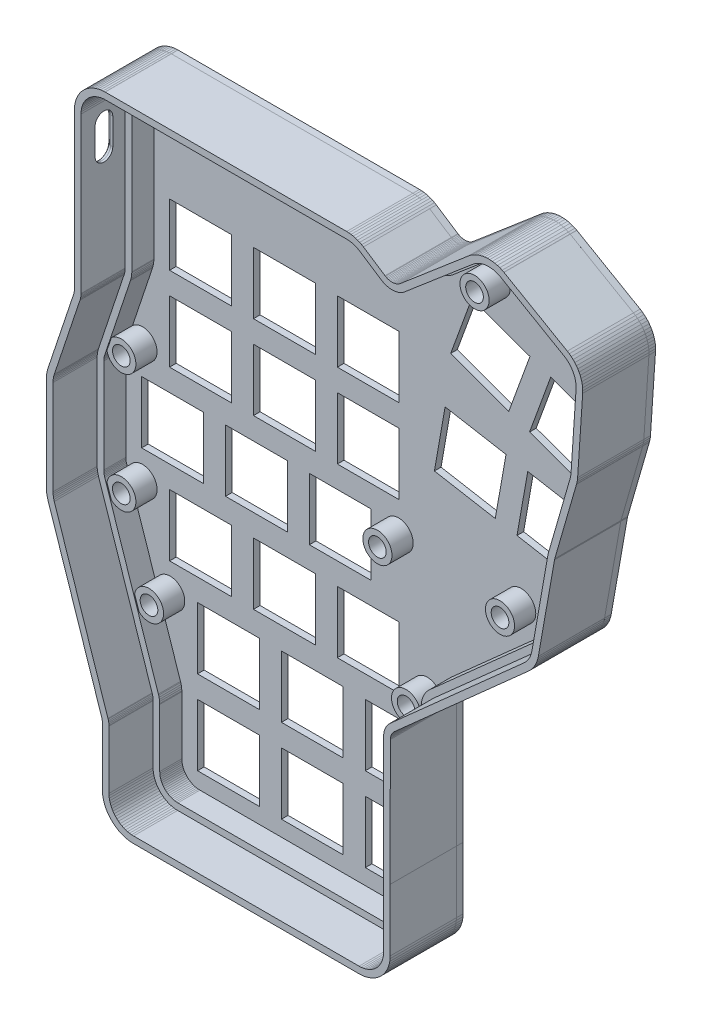
from build123d import *

# Parameters (mm, degrees)
BOSS_EXTRU_1_DEPTH      = 15
ESQUISSE7_W             = 14
ESQUISSE7_H             = 14
BOSS_EXTRU_4_DEPTH      = 1.5
ESQUISSE6_R             = 3.3
ESQUISSE6_R_2           = 2
BOSS_EXTRU_3_DEPTH      = 4.8
ENL_V_MAT_EXTRU_1_DEPTH = 1.5
CONG_1_R                = 1
BOSS_EXTRU_6_DEPTH      = 5


# Read off the part's stored shape, not the designer's step: Boss.-Extru.1, Boss.-Extru.6
with BuildPart() as part:
    # Boss.-Extru.1 outline → Boss.-Extru.1 (new body)
    with BuildSketch(Plane(origin=(0, 0, 0), x_dir=(0, 1, 0), z_dir=(0, 0, 1))):
        Polygon((92.890611184, -113.577539073), (93.43365663, -113.6), (107.473866744, -113.6), (135.881963197, -113.615550131), (136.127746965, -113.636438947), (136.370779918, -113.677913112), (136.609463594, -113.739688722), (136.842102766, -113.821327786), (137.067049329, -113.922251404), (137.282708136, -114.041744237), (137.487545421, -114.178956128), (137.680111288, -114.332916408), (137.859211104, -114.502694203), (137.905542913, -114.554664077), (165.010079912, -144.972955359), (165.037680756, -144.998391426), (165.307449273, -145.279408378), (165.698437591, -145.630402332), (166.114391048, -145.951418588), (166.553021612, -146.240688552), (167.011907492, -146.496613359), (167.488515384, -146.71778199), (167.980220027, -146.902976886), (168.484313313, -147.051176809), (168.938901203, -147.148861525), (168.98446908, -147.157776056), (189.726222944, -150.815137777), (189.777290349, -150.824140806), (189.878703518, -150.845754626), (189.979287041, -150.870948457), (207.036579721, -155.792284367), (207.07970119, -155.80389521), (207.512878427, -155.912301204), (208.009868843, -155.999609992), (208.476336025, -156.047632122), (225.577473488, -157.193574526), (226.100468696, -157.207753169), (226.662689396, -157.178224032), (227.220779935, -157.104095672), (227.771213577, -156.985838939), (228.310504374, -156.824199645), (228.835239223, -156.620203411), (229.342097756, -156.375139099), (229.827869484, -156.090560421), (230.289485828, -155.768265199), (230.724019033, -155.410293915), (231.128718139, -155.018918104), (231.501028693, -154.596607506), (231.838591121, -154.146034836), (232.118006497, -153.703711275), (240.392168816, -139.372442446), (240.409288301, -139.334567479), (240.6129388, -138.945907525), (240.838975505, -138.412391682), (241.02060847, -137.86217168), (241.156618893, -137.298937181), (241.246095602, -136.726465003), (241.288439793, -136.14859307), (241.283366894, -135.569190757), (241.230910317, -134.992147494), (241.131423005, -134.421329857), (240.985571098, -133.860564784), (240.794332009, -133.313609221), (240.558988167, -132.784134379), (240.281118344, -132.275686415), (239.962583612, -131.791676379), (239.630773978, -131.367619294), (226.497075815, -115.929518886), (226.41593607, -115.834194414), (226.270749831, -115.630561218), (226.143356067, -115.415038473), (226.034841663, -115.189421732), (225.945999109, -114.955356276), (225.877478213, -114.714557935), (225.829781211, -114.468786228), (225.803255113, -114.219835987), (225.798095215, -113.969532189), (225.814338608, -113.719704043), (225.8518675, -113.472173954), (225.910406127, -113.228754967), (225.989526605, -112.991230208), (226.088651163, -112.761332098), (226.208726848, -112.537627729), (226.27498831, -112.436153953), (229.469816673, -107.540749632), (229.714951025, -107.133666809), (229.946389499, -106.677761657), (230.144306928, -106.206335778), (230.30766857, -105.721844577), (230.435619903, -105.226826504), (230.527494713, -104.723861371), (230.582812937, -104.215572762), (230.599978167, -103.740753368), (230.600038397, -49.043095703), (230.595853087, -49.000737957), (230.577519345, -48.557302879), (230.505179011, -47.976896773), (230.38515628, -47.404452395), (230.218272052, -46.843874393), (230.005664168, -46.298992111), (229.748787209, -45.773527785), (229.449392245, -45.271068769), (229.109529637, -44.795054768), (228.731518792, -44.348729444), (228.317938879, -43.935144898), (227.871618833, -43.557125075), (227.395605387, -43.217255942), (226.893154507, -42.917856199), (226.367692563, -42.660971481), (225.822813936, -42.448356923), (225.262236448, -42.281464066), (224.689791378, -42.161433954), (224.109391659, -42.089087223), (223.566343567, -42.066625439), (188.336506682, -42.066667), (188.242363927, -42.066655716), (188.054343274, -42.054539863), (187.867606955, -42.030373679), (187.682585221, -41.99420577), (187.500613653, -41.946304458), (187.41131672, -41.916550692), (169.920395126, -36.08621789), (169.51493006, -35.965411261), (169.071164343, -35.863742546), (168.621786248, -35.790819777), (168.168643572, -35.746943017), (167.745789774, -35.733333), (146.275020194, -35.733333), (146.234802643, -35.733942615), (145.831347869, -35.74692949), (145.378193774, -35.790809874), (144.928801731, -35.86374071), (144.485031709, -35.965420171), (144.07958845, -36.086228077), (107.588674011, -48.249865223), (107.499352713, -48.279628892), (107.317162447, -48.327589712), (107.132373208, -48.36371455), (106.945646947, -48.387880696), (106.757639166, -48.399996314), (106.663551385, -48.400007003), (93.433657028, -48.399999984), (92.890611184, -48.422460927), (92.310211298, -48.494806629), (91.737770398, -48.614835976), (91.177197004, -48.781724707), (90.632316588, -48.994338146), (90.106858283, -49.251219793), (89.604407347, -49.550614897), (89.128394182, -49.89048167), (88.68207455, -50.268495326), (88.268495326, -50.68207455), (87.89048167, -51.128394182), (87.550614897, -51.604407347), (87.251219793, -52.106858283), (86.994338146, -52.632316588), (86.781724707, -53.177197004), (86.614835976, -53.737770398), (86.494806629, -54.310211298), (86.422460927, -54.890611184), (86.4, -55.43365663), (86.4, -106.56634337), (86.422460927, -107.109388816), (86.494806629, -107.689788702), (86.614835976, -108.262229602), (86.781724707, -108.822802996), (86.994338146, -109.367683412), (87.251219793, -109.893141717), (87.550614897, -110.395592653), (87.89048167, -110.871605818), (88.268495326, -111.31792545), (88.68207455, -111.731504674), (89.128394182, -112.10951833), (89.604407347, -112.449385103), (90.106858283, -112.748780207), (90.632316588, -113.005661854), (91.177197004, -113.218275293), (91.737770398, -113.385164024), (92.310211298, -113.505193371), align=None)
        Polygon((145.927863967, -37.244599622), (146.270301747, -37.233576835), (146.286388, -37.233333), (167.721656444, -37.233333), (168.072133893, -37.244613504), (168.429169562, -37.279184444), (168.783242836, -37.336641636), (169.132889765, -37.416747315), (169.468950531, -37.516875223), (186.937059323, -43.339603723), (187.072163838, -43.384620589), (187.347429881, -43.457080286), (187.627214739, -43.51177242), (187.909707068, -43.548330716), (188.193994982, -43.566649929), (188.33641767, -43.566667), (223.535335892, -43.566625475), (223.985415185, -43.585241845), (224.442687179, -43.642240725), (224.893690127, -43.736806889), (225.33534377, -43.86829422), (225.764629662, -44.035803875), (226.178617058, -44.238191577), (226.574476261, -44.474075617), (226.949505607, -44.741843051), (227.301140549, -45.039667403), (227.626981528, -45.365512031), (227.924799326, -45.717151745), (228.192562693, -46.092183034), (228.428441895, -46.488046846), (228.630823773, -46.90203671), (228.798328058, -47.331325198), (228.929808643, -47.772979417), (229.024369233, -48.223982972), (229.081362711, -48.68125709), (229.098905149, -49.105553045), (229.100038315, -49.117021338), (229.099978197, -103.713648092), (229.085751213, -104.107190611), (229.042166732, -104.50766433), (228.969779537, -104.90394526), (228.868967952, -105.293965089), (228.740257449, -105.675689376), (228.58432026, -106.047121174), (228.401971934, -106.406324808), (228.198817179, -106.743694135), (225.018934894, -111.616196726), (224.91755405, -111.771452837), (224.736647791, -112.108486275), (224.586690901, -112.456279052), (224.466995782, -112.815611492), (224.378438125, -113.183857489), (224.321664152, -113.558322761), (224.297090804, -113.936268047), (224.304896778, -114.314931497), (224.345025553, -114.691544307), (224.417182303, -115.063351484), (224.520841527, -115.427634069), (224.655243166, -115.781729933), (224.819405767, -116.123047118), (225.012128458, -116.449092305), (225.231963517, -116.757425353), (225.354710454, -116.901630721), (238.468368494, -132.316174824), (238.743371153, -132.667631845), (238.994331836, -133.048963854), (239.213254042, -133.449549095), (239.398672002, -133.866701055), (239.549341274, -134.297624446), (239.664252001, -134.739428214), (239.742634079, -135.189152623), (239.783962473, -135.643781439), (239.787959198, -136.100268268), (239.7545979, -136.555550501), (239.684102723, -137.006578795), (239.576945867, -137.45032742), (239.433844876, -137.883822671), (239.25575995, -138.304157631), (239.060393575, -138.67700762), (239.055944204, -138.686851362), (230.833896624, -152.927854819), (230.60231803, -153.294451209), (230.336363673, -153.649442626), (230.043031535, -153.982168276), (229.724179758, -154.290522979), (229.381824707, -154.5725573), (229.018132371, -154.826483105), (228.635406689, -155.050694525), (228.236068556, -155.243773103), (227.822645593, -155.404495661), (227.397755144, -155.531846235), (226.964084984, -155.625017168), (226.524381599, -155.683420758), (226.081426424, -155.706685792), (225.647971622, -155.694934632), (208.603326756, -154.55277778), (208.216706211, -154.512975748), (207.825122607, -154.444184301), (207.45680849, -154.35201081), (207.439519059, -154.347355475), (190.44494083, -149.444114804), (190.36955926, -149.422364364), (190.217371629, -149.384244907), (190.063928837, -149.351542201), (169.258724484, -145.682994786), (169.240489127, -145.679427368), (168.853932857, -145.596361716), (168.456769645, -145.479598492), (168.069366568, -145.333687581), (167.693857104, -145.159433408), (167.332312109, -144.957796493), (166.986726094, -144.729887947), (166.659004315, -144.476965374), (166.35095245, -144.200424267), (166.087972988, -143.92647945), (166.080879959, -143.919942739), (139.052097173, -113.586677636), (139.051897728, -113.586428269), (138.936913776, -113.457452051), (138.666184822, -113.200814352), (138.374869355, -112.967901782), (138.064989534, -112.760326309), (137.738742332, -112.579558351), (137.398443941, -112.426881446), (137.046506149, -112.30337743), (136.68542448, -112.209923028), (136.317761741, -112.147180487), (135.946064313, -112.115590447), (135.922675359, -112.115572192), (107.474277282, -112.1), (93.464664158, -112.1), (93.014585296, -112.081384268), (92.557314324, -112.024386343), (92.10631335, -111.929820506), (91.664661751, -111.798336073), (91.235376147, -111.630827964), (90.821389821, -111.428441802), (90.425530337, -111.192561276), (90.050501046, -110.924795583), (89.698865637, -110.626975419), (89.373024581, -110.301134363), (89.075204417, -109.949498954), (88.807438724, -109.574469663), (88.571558198, -109.178610179), (88.369172036, -108.764623853), (88.201663927, -108.335338249), (88.070179494, -107.89368665), (87.975613657, -107.442685676), (87.918615732, -106.985414704), (87.9, -106.535335842), (87.9, -55.464664158), (87.918615732, -55.014585296), (87.975613657, -54.557314324), (88.070179494, -54.10631335), (88.201663927, -53.664661751), (88.369172036, -53.235376147), (88.571558198, -52.821389821), (88.807438724, -52.425530337), (89.075204417, -52.050501046), (89.373024581, -51.698865637), (89.698865637, -51.373024581), (90.050501046, -51.075204417), (90.425530337, -50.807438724), (90.821389821, -50.571558198), (91.235376147, -50.369172036), (91.664661751, -50.201663927), (92.10631335, -50.070179494), (92.557314324, -49.975613657), (93.014585296, -49.918615732), (93.464664158, -49.9), (106.663636196, -49.900007003), (106.806005792, -49.899990828), (107.090290487, -49.881670924), (107.372779552, -49.845111137), (107.652334112, -49.790460428), (107.927822678, -49.717939223), (108.062943253, -49.672914306), (144.531044612, -37.516881519), (144.867099927, -37.416748793), (145.216747933, -37.336635177), (145.570823944, -37.279172968), align=None, mode=Mode.SUBTRACT)
    extrude(amount=BOSS_EXTRU_1_DEPTH)

    # Esquisse7 → Boss.-Extru.4 (add)
    with BuildSketch(Plane(origin=(0, 0, 0), x_dir=(1, 0, 0), z_dir=(0, 0, -1))):
        Polygon((113.600270421, -106.680013171), (113.600268673, -107.473879916), (113.615756242, -135.881976403), (113.636644516, -136.127760217), (113.678118146, -136.370793261), (113.73989323, -136.609477073), (113.821531782, -136.842116424), (113.922454905, -137.06706321), (114.041947262, -137.28272228), (114.179158702, -137.487559867), (114.333118559, -137.680126073), (114.502895959, -137.859226264), (114.554865731, -137.905558187), (144.973097321, -165.010162175), (144.998533327, -165.037763075), (145.279549685, -165.307532211), (145.630542778, -165.698521302), (145.951558118, -166.114475465), (146.240827116, -166.553106666), (146.496750913, -167.01199311), (146.717918494, -167.488601489), (146.903112307, -167.98030654), (147.05131112, -168.484400153), (147.148994835, -168.938988258), (147.157909265, -168.984556155), (150.815225307, -189.726318072), (150.824228224, -189.777385497), (150.845841821, -189.878798714), (150.87103543, -189.979382293), (150.885411575, -190.029206821), (155.792333775, -207.03668581), (155.803944524, -207.079807305), (155.912349564, -207.512984781), (155.999657257, -208.009975389), (156.047678359, -208.476442677), (157.193583102, -225.577582663), (157.207760593, -226.100577903), (157.178230219, -226.662798538), (157.104100629, -227.220888914), (156.985842684, -227.771322296), (156.824202203, -228.310612736), (156.620204813, -228.835347136), (156.375139385, -229.342205129), (156.090559637, -229.827976231), (155.768263399, -230.289591865), (155.410291158, -230.724124281), (155.018914455, -231.128822526), (154.596603037, -231.50113215), (154.146029624, -231.838693585), (153.703705447, -232.118107988), (139.372418397, -240.392238745), (139.334543392, -240.409358146), (138.945882989, -240.61300779), (138.412366649, -240.83904332), (137.862146247, -241.020675073), (137.298911448, -241.156684255), (136.726439073, -241.246159704), (136.148567047, -241.288502622), (135.569164744, -241.283428447), (134.992121597, -241.230970599), (134.421304179, -241.13148203), (133.860539427, -240.985628888), (133.313584286, -240.794388595), (132.784109962, -240.559043586), (132.27566261, -240.281172644), (131.791653275, -239.962636846), (131.367596922, -239.630826278), (115.929525437, -226.497094116), (115.834201144, -226.415954161), (115.630568268, -226.270767473), (115.415045803, -226.143373235), (115.189429301, -226.034858334), (114.955364041, -225.946015265), (114.714565851, -225.877493839), (114.468794249, -225.829796295), (114.219844066, -225.803269649), (113.969540279, -225.798109199), (113.719712098, -225.814352043), (113.472181926, -225.851880389), (113.22876281, -225.91041848), (112.991237877, -225.989538435), (112.761339549, -226.088662487), (112.537634915, -226.208737679), (112.436160994, -226.274998918), (107.540749637, -229.4698165), (107.133666274, -229.714949955), (106.677760612, -229.946387426), (106.206334298, -230.144303816), (105.721842736, -230.307664391), (105.226824381, -230.435614634), (104.723859046, -230.527488336), (104.215570316, -230.582805441), (103.740750884, -230.599969625), (49.043093218, -230.599909396), (49.000735482, -230.595723993), (48.557300444, -230.577389274), (47.976894498, -230.505047662), (47.404450384, -230.385023671), (46.84387275, -230.218138208), (46.298990936, -230.005529124), (45.773527175, -229.748651008), (45.271068819, -229.449254938), (44.795055566, -229.109391281), (44.348731074, -228.731379453), (43.935147439, -228.317798629), (43.5571286, -227.87147775), (43.217260514, -227.395463557), (42.917861878, -226.893012017), (42.660978318, -226.367549507), (42.448364959, -225.822670412), (42.281473337, -225.262092556), (42.161444485, -224.689647222), (42.089099033, -224.109247344), (42.066638444, -223.566199202), (42.066757591, -188.336362317), (42.066746514, -188.242219562), (42.054631076, -188.054198882), (42.030465303, -187.86746251), (41.994297801, -187.682440696), (41.94639689, -187.500469024), (41.916643321, -187.411172025), (36.086349039, -169.92023759), (35.965543302, -169.514772258), (35.863875565, -169.071006318), (35.790953785, -168.621628062), (35.747078023, -168.168485289), (35.733468938, -167.745631462), (35.733516222, -146.274861882), (35.734125926, -146.234644332), (35.747113689, -145.831189587), (35.790995071, -145.378035589), (35.863926897, -144.928643706), (35.965607335, -144.484873908), (36.086416134, -144.079430915), (48.250133643, -107.588543264), (48.279897508, -107.499222031), (48.32785873, -107.317031871), (48.363983974, -107.132242711), (48.388150532, -106.945516504), (48.400266564, -106.757508749), (48.40027746, -106.663420968), (48.400299577, -93.433526611), (48.422761716, -92.890480817), (48.495108696, -92.31008109), (48.615139304, -91.737640455), (48.782029269, -91.177067428), (48.994643908, -90.632187481), (49.251526713, -90.106729741), (49.550922923, -89.604279464), (49.890790744, -89.128267048), (50.268805383, -88.681948248), (50.682385518, -88.268369935), (51.128705983, -87.890357262), (51.604719896, -87.550491537), (52.107171492, -87.25109754), (52.632630363, -86.99421705), (53.177511246, -86.781604811), (53.738085008, -86.614717315), (54.310526172, -86.494689228), (54.890926218, -86.422344804), (55.433971713, -86.399885073), (106.566658453, -86.399997681), (107.109703849, -86.422459804), (107.690103576, -86.494806784), (108.262544211, -86.614837392), (108.823117238, -86.781727358), (109.367997186, -86.994341996), (109.893454925, -87.251224801), (110.395905202, -87.550621011), (110.871917618, -87.890488832), (111.318236418, -88.268503471), (111.731814731, -88.682083606), (112.109827404, -89.128404071), (112.449693129, -89.604417984), (112.749087126, -90.10686958), (113.005967616, -90.632328451), (113.218579855, -91.177209335), (113.385467351, -91.737783097), (113.505495438, -92.31022426), (113.577839862, -92.890624306), (113.600299593, -93.433669801), align=None)
        Polygon((129.985643815, -221.938205772), (142.109999428, -214.938205795), (149.109999405, -227.062561409), (136.985643792, -234.062561386), align=None, mode=Mode.SUBTRACT)
        Polygon((112.308368192, -203.476419086), (125.464064792, -198.688137086), (130.252346792, -211.843833686), (117.096650192, -216.632115686), align=None, mode=Mode.SUBTRACT)
        Polygon((130.162527992, -196.978036386), (143.318224592, -192.189754386), (148.106506592, -205.345450986), (134.950809992, -210.133732986), align=None, mode=Mode.SUBTRACT)
        Polygon((108.608626892, -178.556247086), (122.395935392, -176.125172586), (124.827009892, -189.912481086), (111.039701392, -192.343555586), align=None, mode=Mode.SUBTRACT)
        Polygon((127.319974192, -175.256931686), (141.107282692, -172.825857186), (143.538357192, -186.613165686), (129.751048692, -189.044240186), align=None, mode=Mode.SUBTRACT)
        with Locations((55.629165692, -194.935048686)):
            Rectangle(ESQUISSE7_W, ESQUISSE7_H, mode=Mode.SUBTRACT)
        with Locations((74.629165692, -194.935048686)):
            Rectangle(ESQUISSE7_W, ESQUISSE7_H, mode=Mode.SUBTRACT)
        with Locations((93.629165692, -194.935048686)):
            Rectangle(ESQUISSE7_W, ESQUISSE7_H, mode=Mode.SUBTRACT)
        with Locations((55.629165692, -175.935048686)):
            Rectangle(ESQUISSE7_W, ESQUISSE7_H, mode=Mode.SUBTRACT)
        with Locations((74.629165692, -175.935048686)):
            Rectangle(ESQUISSE7_W, ESQUISSE7_H, mode=Mode.SUBTRACT)
        with Locations((93.629165692, -175.935048686)):
            Rectangle(ESQUISSE7_W, ESQUISSE7_H, mode=Mode.SUBTRACT)
        with Locations((49.295832292, -156.935048686)):
            Rectangle(ESQUISSE7_W, ESQUISSE7_H, mode=Mode.SUBTRACT)
        with Locations((68.295832292, -156.935048686)):
            Rectangle(ESQUISSE7_W, ESQUISSE7_H, mode=Mode.SUBTRACT)
        with Locations((87.295832292, -156.935048686)):
            Rectangle(ESQUISSE7_W, ESQUISSE7_H, mode=Mode.SUBTRACT)
        with Locations((55.629165692, -137.935048686)):
            Rectangle(ESQUISSE7_W, ESQUISSE7_H, mode=Mode.SUBTRACT)
        with Locations((74.629165692, -137.935048686)):
            Rectangle(ESQUISSE7_W, ESQUISSE7_H, mode=Mode.SUBTRACT)
        with Locations((93.629165692, -137.935048686)):
            Rectangle(ESQUISSE7_W, ESQUISSE7_H, mode=Mode.SUBTRACT)
        with Locations((61.962498992, -118.935048686)):
            Rectangle(ESQUISSE7_W, ESQUISSE7_H, mode=Mode.SUBTRACT)
        with Locations((80.962498992, -118.935048686)):
            Rectangle(ESQUISSE7_W, ESQUISSE7_H, mode=Mode.SUBTRACT)
        with Locations((99.962498992, -118.935048686)):
            Rectangle(ESQUISSE7_W, ESQUISSE7_H, mode=Mode.SUBTRACT)
        with Locations((61.962498992, -99.935048686)):
            Rectangle(ESQUISSE7_W, ESQUISSE7_H, mode=Mode.SUBTRACT)
        with Locations((80.962498992, -99.935048686)):
            Rectangle(ESQUISSE7_W, ESQUISSE7_H, mode=Mode.SUBTRACT)
        with Locations((99.962498992, -99.935048686)):
            Rectangle(ESQUISSE7_W, ESQUISSE7_H, mode=Mode.SUBTRACT)
    extrude(amount=BOSS_EXTRU_4_DEPTH)

    # Esquisse6 → Boss.-Extru.3 (add)
    # profile 1 of 9: a face of its own
    with BuildSketch(Plane.YX):
        with Locations(Location((170.5, 42.5, 0), (0, 0, 90))):
            Circle(ESQUISSE6_R)
        with Locations(Location((170.5, 42.5, 0), (0, 0, 90))):
            Circle(ESQUISSE6_R_2, mode=Mode.SUBTRACT)
    # profile 2 of 9: a face of its own
    with BuildSketch(Plane.YX):
        with Locations(Location((143.5, 42.5, 0), (0, 0, 90))):
            Circle(ESQUISSE6_R)
        with Locations(Location((143.5, 42.5, 0), (0, 0, 90))):
            Circle(ESQUISSE6_R_2, mode=Mode.SUBTRACT)
    # profile 3 of 9: a face of its own
    with BuildSketch(Plane.YX):
        with Locations(Location((124.714, 48.768, 0), (0, 0, 90))):
            Circle(ESQUISSE6_R)
        with Locations(Location((124.714, 48.768, 0), (0, 0, 90))):
            Circle(ESQUISSE6_R_2, mode=Mode.SUBTRACT)
    # profile 4 of 9: a face of its own
    with BuildSketch(Plane.YX):
        with Locations(Location((134, 107, 0), (0, 0, 90))):
            Circle(ESQUISSE6_R)
        with Locations(Location((134, 107, 0), (0, 0, 90))):
            Circle(ESQUISSE6_R_2, mode=Mode.SUBTRACT)
    # profile 5 of 9: a face of its own
    with BuildSketch(Plane.YX):
        with Locations(Location((162, 100.5, 0), (0, 0, 90))):
            Circle(ESQUISSE6_R)
        with Locations(Location((162, 100.5, 0), (0, 0, 90))):
            Circle(ESQUISSE6_R_2, mode=Mode.SUBTRACT)
    # profile 6 of 9: a face of its own
    with BuildSketch(Plane.YX):
        with Locations(Location((162.052, 128.27, 0), (0, 0, 90))):
            Circle(ESQUISSE6_R)
        with Locations(Location((162.052, 128.27, 0), (0, 0, 90))):
            Circle(ESQUISSE6_R_2, mode=Mode.SUBTRACT)
    # profile 7 of 9: a face of its own
    with BuildSketch(Plane.YX):
        with Locations(Location((213.614, 150.368, 0), (0, 0, 90))):
            Circle(ESQUISSE6_R)
        with Locations(Location((213.614, 150.368, 0), (0, 0, 90))):
            Circle(ESQUISSE6_R_2, mode=Mode.SUBTRACT)
    # profile 8 of 9: a face of its own
    with BuildSketch(Plane.YX):
        with Locations(Location((223, 122.5, 0), (0, 0, 90))):
            Circle(ESQUISSE6_R)
        with Locations(Location((223, 122.5, 0), (0, 0, 90))):
            Circle(ESQUISSE6_R_2, mode=Mode.SUBTRACT)
    # profile 9 of 9: a face of its own
    with BuildSketch(Plane.YX):
        with Locations(Location((224.5, 86.5, 0), (0, 0, 270))):
            Circle(ESQUISSE6_R)
        with Locations(Location((224.5, 86.5, 0), (0, 0, 90))):
            Circle(ESQUISSE6_R_2, mode=Mode.SUBTRACT)
    extrude(amount=-BOSS_EXTRU_3_DEPTH)

    # Esquisse10 → Enlèv. mat.-Extru.1 (cut)
    with BuildSketch(Plane(origin=(42.066889184, 4.9627e-05, 0), x_dir=(1.1797197881461008e-06, -0.9999999999993041, 0), z_dir=(-0.9999999999993041, -1.1797197881461008e-06, 0))):
        with BuildLine():
            Line((-219.536701162, 11.8), (-213.536701162, 11.8))
            ThreePointArc((-213.536701162, 11.8), (-211.536701162, 9.8), (-213.536701162, 7.8))
            Line((-213.536701162, 7.8), (-219.536701162, 7.8))
            ThreePointArc((-219.536701162, 7.8), (-221.536701162, 9.8), (-219.536701162, 11.8))
        make_face()
    extrude(amount=-ENL_V_MAT_EXTRU_1_DEPTH, mode=Mode.SUBTRACT)

    # Congé1
    cong_1_edges = [part.edges().sort_by_distance(p)[0] for p in [
        (42.066633731, 216.536750789, 11.8),
        (42.066627833, 221.536750789, 9.8),
        (42.066633731, 216.536750789, 7.8),
        (42.06663963, 211.536750789, 9.8),
    ]]
    fillet(cong_1_edges, radius=CONG_1_R)

    # Boss.-Extru.6 outline → Boss.-Extru.6 (add)
    with BuildSketch(Plane.XY):
        Polygon((37.233333, 146.286388), (37.233576835, 146.270301747), (37.244599622, 145.927863967), (37.279172968, 145.570823944), (37.336635177, 145.216747933), (37.416748793, 144.867099927), (37.516881519, 144.531044612), (49.672914306, 108.062943253), (49.717939223, 107.927822678), (49.790460428, 107.652334112), (49.845111137, 107.372779552), (49.881670924, 107.090290487), (49.899990828, 106.806005792), (49.900007003, 106.663636196), (49.9, 93.464664158), (49.918615732, 93.014585296), (49.975613657, 92.557314324), (50.070179494, 92.10631335), (50.201663927, 91.664661751), (50.369172036, 91.235376147), (50.571558198, 90.821389821), (50.807438724, 90.425530337), (51.075204417, 90.050501046), (51.373024581, 89.698865637), (51.698865637, 89.373024581), (52.050501046, 89.075204417), (52.425530337, 88.807438724), (52.821389821, 88.571558198), (53.235376147, 88.369172036), (53.664661751, 88.201663927), (54.10631335, 88.070179494), (54.557314324, 87.975613657), (55.014585296, 87.918615732), (55.464664158, 87.9), (106.535335842, 87.9), (106.985414704, 87.918615732), (107.442685676, 87.975613657), (107.89368665, 88.070179494), (108.335338249, 88.201663927), (108.764623853, 88.369172036), (109.178610179, 88.571558198), (109.574469663, 88.807438724), (109.949498954, 89.075204417), (110.301134363, 89.373024581), (110.626975419, 89.698865637), (110.924795583, 90.050501046), (111.192561276, 90.425530337), (111.428441802, 90.821389821), (111.630827964, 91.235376147), (111.798336073, 91.664661751), (111.929820506, 92.10631335), (112.024386343, 92.557314324), (112.081384268, 93.014585296), (112.1, 93.464664158), (112.1, 107.474277282), (112.115572192, 135.922675359), (112.115590447, 135.946064313), (112.147180487, 136.317761741), (112.209923028, 136.68542448), (112.30337743, 137.046506149), (112.426881446, 137.398443941), (112.579558351, 137.738742332), (112.760326309, 138.064989534), (112.967901782, 138.374869355), (113.200814352, 138.666184822), (113.457452051, 138.936913776), (113.586428269, 139.051897728), (113.586677636, 139.052097173), (143.919942739, 166.080879959), (143.92647945, 166.087972988), (144.200424267, 166.35095245), (144.476965374, 166.659004315), (144.729887947, 166.986726094), (144.957796493, 167.332312109), (145.159433408, 167.693857104), (145.333687581, 168.069366568), (145.479598492, 168.456769645), (145.596361716, 168.853932857), (145.679427368, 169.240489127), (145.682994786, 169.258724484), (149.351544634, 190.063928837), (149.384244907, 190.217371629), (149.422364364, 190.36955926), (149.444114804, 190.44494083), (154.347355475, 207.439519059), (154.35201081, 207.45680849), (154.444184301, 207.825122607), (154.512975748, 208.216706211), (154.55277778, 208.603326756), (155.694934632, 225.647971622), (155.706685792, 226.081426424), (155.683420758, 226.524381599), (155.625017168, 226.964084984), (155.531846235, 227.397755144), (155.404495661, 227.822645593), (155.243773103, 228.236068556), (155.050694525, 228.635406689), (154.826483105, 229.018132371), (154.5725573, 229.381824707), (154.290522979, 229.724179758), (153.982168276, 230.043031535), (153.649442626, 230.336363673), (153.294451209, 230.60231803), (152.927854819, 230.833896624), (138.686851362, 239.055944204), (138.67700762, 239.060393575), (138.304157631, 239.25575995), (137.883822671, 239.433844876), (137.45032742, 239.576945867), (137.006578795, 239.684102723), (136.555550501, 239.7545979), (136.100268268, 239.787959198), (135.643781439, 239.783962473), (135.189152623, 239.742634079), (134.739428214, 239.664252001), (134.297624446, 239.549341274), (133.866701055, 239.398672002), (133.449549095, 239.213254042), (133.048963854, 238.994331836), (132.667631845, 238.743371153), (132.316174824, 238.468368494), (116.901630721, 225.354710454), (116.757425353, 225.231963517), (116.449092305, 225.012128458), (116.123047118, 224.819405767), (115.781729933, 224.655243166), (115.427634069, 224.520841527), (115.063351484, 224.417182303), (114.691544307, 224.345025553), (114.314931497, 224.304896778), (113.936268047, 224.297090804), (113.558322761, 224.321664152), (113.183857489, 224.378438125), (112.815611492, 224.466995782), (112.456279052, 224.586690901), (112.108486275, 224.736647791), (111.771452837, 224.91755405), (111.616196726, 225.018934894), (106.743694135, 228.198817179), (106.406324808, 228.401971934), (106.047121174, 228.58432026), (105.675689376, 228.740257449), (105.293965089, 228.868967952), (104.90394526, 228.969779537), (104.50766433, 229.042166732), (104.107190611, 229.085751213), (103.713648092, 229.099978197), (49.117021338, 229.100038315), (49.105553045, 229.098905149), (48.68125709, 229.081362711), (48.223982972, 229.024369233), (47.772979417, 228.929808643), (47.331325198, 228.798328058), (46.90203671, 228.630823773), (46.488046846, 228.428441895), (46.092183034, 228.192562693), (45.717151745, 227.924799326), (45.365512031, 227.626981528), (45.039667403, 227.301140549), (44.741843051, 226.949505607), (44.474075617, 226.574476261), (44.238191577, 226.178617058), (44.035803875, 225.764629662), (43.86829422, 225.33534377), (43.736806889, 224.893690127), (43.642240725, 224.442687179), (43.585241845, 223.985415185), (43.566625475, 223.535335892), (43.566667, 188.33641767), (43.566649929, 188.193994982), (43.548330716, 187.909707068), (43.51177242, 187.627214739), (43.457080286, 187.347429881), (43.384620589, 187.072163838), (43.339603723, 186.937059323), (37.516875223, 169.468950531), (37.416747315, 169.132889765), (37.336641636, 168.783242836), (37.279184444, 168.429169562), (37.244613504, 168.072133893), (37.233333, 167.721656444), align=None)
        Polygon((44.762656754, 186.462801925), (44.822936721, 186.643714023), (44.919954802, 187.012274541), (44.99317116, 187.386822523), (45.042121568, 187.765070863), (45.066644142, 188.145626037), (45.066667, 188.336328659), (45.066625512, 223.504328216), (45.081396467, 223.861438711), (45.123047496, 224.19558298), (45.192149712, 224.525143805), (45.288231518, 224.847873603), (45.410636269, 225.161566761), (45.558526954, 225.464079608), (45.730895293, 225.753347135), (45.926561026, 226.02739238), (46.144189908, 226.284342219), (46.382294619, 226.522444263), (46.639248722, 226.740069014), (46.913297299, 226.935733142), (47.202565906, 227.108096581), (47.505081309, 227.255983379), (47.818776003, 227.378384065), (48.141506439, 227.474461006), (48.471069171, 227.543559456), (48.8052113, 227.585206077), (49.163954863, 227.600038264), (103.686542816, 227.599978227), (103.99880846, 227.588689489), (104.291467289, 227.556838752), (104.581064017, 227.503939172), (104.8660856, 227.430267334), (105.145042973, 227.33620797), (105.41648069, 227.22225102), (105.678982808, 227.088992842), (105.946638637, 226.927817685), (110.796239499, 223.762881478), (111.005277945, 223.626381253), (111.455640451, 223.384644418), (111.921327896, 223.183855198), (112.402468017, 223.023585437), (112.895541023, 222.90500875), (113.396941478, 222.828989696), (113.903003906, 222.796086393), (114.410027007, 222.806538443), (114.914302386, 222.860269895), (115.412145032, 222.956886393), (115.899911862, 223.095683945), (116.374038134, 223.275644669), (116.831055764, 223.495455466), (117.267623391, 223.753507085), (117.680656293, 224.047990965), (117.873742557, 224.212345092), (133.264730353, 237.305963011), (133.543587311, 237.524158694), (133.822241292, 237.707545328), (134.11496381, 237.867519916), (134.41979289, 238.003011995), (134.734684108, 238.113111451), (135.057526572, 238.197080997), (135.386157753, 238.254357841), (135.718372122, 238.284558053), (136.051943465, 238.287478603), (136.384635999, 238.263100199), (136.71422041, 238.211586553), (137.03848316, 238.133283265), (137.355253659, 238.028714247), (137.662407738, 237.8985811), (137.976730055, 237.733882123), (152.151998363, 229.549786751), (152.442867582, 229.36604494), (152.702277747, 229.171698653), (152.945418448, 228.95734493), (153.170752042, 228.724340484), (153.3768494, 228.474163586), (153.56240579, 228.208395258), (153.72624995, 227.928715622), (153.867342794, 227.636897889), (153.984791677, 227.334786813), (154.07785353, 227.024296711), (154.145938664, 226.707390033), (154.188617484, 226.386073802), (154.205618416, 226.062384152), (154.196294737, 225.718469756), (153.057923439, 208.730317488), (153.026341503, 208.423543579), (152.976067397, 208.137366787), (152.901202539, 207.838215871), (147.973782131, 190.759830943), (147.922732423, 190.556028705), (147.87894883, 190.350578532), (144.20901454, 169.537522686), (144.141546623, 169.2235524), (144.056220098, 168.933319264), (143.949593171, 168.650217753), (143.822253457, 168.375806717), (143.674904434, 168.111602607), (143.508357306, 167.859061141), (143.323528415, 167.619571039), (143.121440156, 167.394455627), (142.889379018, 167.171683341), (112.618589485, 140.198570084), (112.618192462, 140.198252543), (112.412209899, 140.014616448), (112.068712296, 139.652258356), (111.756847436, 139.26219329), (111.478908382, 138.847270932), (111.236865298, 138.410435336), (111.032435107, 137.954785117), (110.867066139, 137.483548703), (110.741932944, 137.000069041), (110.657922026, 136.507776517), (110.615640106, 136.010275374), (110.615572512, 135.923671267), (110.6, 107.47468782), (110.6, 93.495671685), (110.585229463, 93.138559408), (110.543579314, 92.804417351), (110.474476988, 92.474856301), (110.378396854, 92.152126498), (110.255994073, 91.838435706), (110.108103397, 91.535921358), (109.935737448, 91.246653327), (109.740072835, 90.972607909), (109.522446163, 90.715656725), (109.284343275, 90.477553837), (109.027392091, 90.259927165), (108.753346673, 90.064262552), (108.464078642, 89.891896603), (108.161564294, 89.744005927), (107.847873502, 89.621603146), (107.525143699, 89.525523012), (107.195582649, 89.456420686), (106.861440592, 89.414770537), (106.504328315, 89.4), (55.495671685, 89.4), (55.138559408, 89.414770537), (54.804417351, 89.456420686), (54.474856301, 89.525523012), (54.152126498, 89.621603146), (53.838435706, 89.744005927), (53.535921358, 89.891896603), (53.246653327, 90.064262552), (52.972607909, 90.259927165), (52.715656725, 90.477553837), (52.477553837, 90.715656725), (52.259927165, 90.972607909), (52.064262552, 91.246653327), (51.891896603, 91.535921358), (51.744005927, 91.838435706), (51.621603146, 92.152126498), (51.525523012, 92.474856301), (51.456420686, 92.804417351), (51.414770537, 93.138559408), (51.400000016, 93.495671287), (51.400007003, 106.663721006), (51.399985343, 106.854372417), (51.375461152, 107.234934026), (51.326507725, 107.613185896), (51.253331144, 107.987505776), (51.156249554, 108.356292643), (51.095963389, 108.537212494), (38.947534961, 144.982500775), (38.868077415, 145.249168145), (38.809529645, 145.504694135), (38.767536063, 145.763454113), (38.742269755, 146.024380066), (38.733333, 146.302012423), (38.733333, 167.697523113), (38.742283991, 167.975624214), (38.767549112, 168.236552876), (38.809540727, 168.495321328), (38.86808337, 168.75084947), (38.947532555, 169.017505937), align=None, mode=Mode.SUBTRACT)
    extrude(amount=BOSS_EXTRU_6_DEPTH)


solid = part.part
